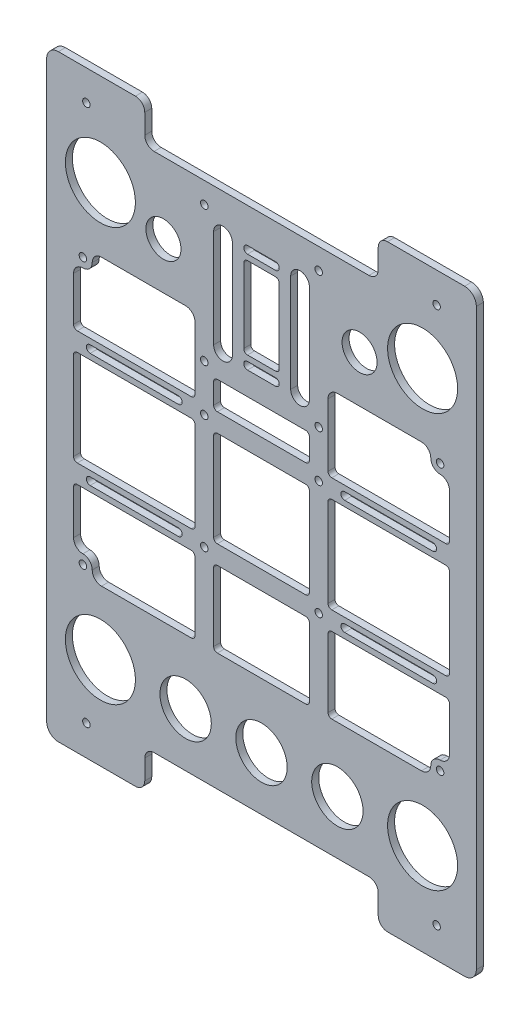
from build123d import *

# Parameters (mm, degrees)
MODEL_R             = 1.6
MODEL_R_2           = 15
MODEL_R_3           = 11
MODEL_R_4           = 7.5
BOSS_EXTRUDE1_DEPTH = 3


with BuildPart() as part:
    # Model → Boss-Extrude1 (new body)
    with BuildSketch(Plane.XY):
        with BuildLine():
            Line((-87, -128), (-54, -128))
            ThreePointArc((-54, -128), (-51.171572875, -126.828427125), (-50, -124))
            Line((-50, -124), (-50, -115.5))
            ThreePointArc((-50, -115.5), (-48.828427125, -112.671572875), (-46, -111.5))
            Line((-46, -111.5), (46, -111.5))
            ThreePointArc((46, -111.5), (48.828427125, -112.671572875), (50, -115.5))
            Line((50, -115.5), (50, -124))
            ThreePointArc((50, -124), (51.171572875, -126.828427125), (54, -128))
            Line((54, -128), (87, -128))
            ThreePointArc((87, -128), (90.535533906, -126.535533906), (92, -123))
            Line((92, -123), (92, 123))
            ThreePointArc((92, 123), (90.535533906, 126.535533906), (87, 128))
            Line((87, 128), (54, 128))
            ThreePointArc((54, 128), (51.171572875, 126.828427125), (50, 124))
            Line((50, 124), (50, 115.5))
            ThreePointArc((50, 115.5), (48.828427125, 112.671572875), (46, 111.5))
            Line((46, 111.5), (-46, 111.5))
            ThreePointArc((-46, 111.5), (-48.828427125, 112.671572875), (-50, 115.5))
            Line((-50, 115.5), (-50, 124))
            ThreePointArc((-50, 124), (-51.171572875, 126.828427125), (-54, 128))
            Line((-54, 128), (-87, 128))
            ThreePointArc((-87, 128), (-90.535533906, 126.535533906), (-92, 123))
            Line((-92, 123), (-92, -123))
            ThreePointArc((-92, -123), (-90.535533906, -126.535533906), (-87, -128))
        make_face()
        with Locations((-75, 115)):
            Circle(MODEL_R, mode=Mode.SUBTRACT)
        with Locations((75, 115)):
            Circle(MODEL_R, mode=Mode.SUBTRACT)
        with Locations((-75, -115)):
            Circle(MODEL_R, mode=Mode.SUBTRACT)
        with Locations((75, -115)):
            Circle(MODEL_R, mode=Mode.SUBTRACT)
        with Locations((-69, 88.5)):
            Circle(MODEL_R_2, mode=Mode.SUBTRACT)
        with Locations((69, 88.5)):
            Circle(MODEL_R_2, mode=Mode.SUBTRACT)
        with Locations((-69, -88.5)):
            Circle(MODEL_R_2, mode=Mode.SUBTRACT)
        with Locations((69, -88.5)):
            Circle(MODEL_R_2, mode=Mode.SUBTRACT)
        with Locations((-24.5, 44.5)):
            Circle(MODEL_R, mode=Mode.SUBTRACT)
        with Locations((24.5, 44.5)):
            Circle(MODEL_R, mode=Mode.SUBTRACT)
        with Locations((-24.5, 102.5)):
            Circle(MODEL_R, mode=Mode.SUBTRACT)
        with Locations((24.5, 102.5)):
            Circle(MODEL_R, mode=Mode.SUBTRACT)
        with Locations((0, -88.5)):
            Circle(MODEL_R_3, mode=Mode.SUBTRACT)
        with Locations((-76.5, -57)):
            Circle(MODEL_R, mode=Mode.SUBTRACT)
        with Locations((-76.5, 57)):
            Circle(MODEL_R, mode=Mode.SUBTRACT)
        with Locations((76.5, -57)):
            Circle(MODEL_R, mode=Mode.SUBTRACT)
        with Locations((76.5, 57)):
            Circle(MODEL_R, mode=Mode.SUBTRACT)
        with Locations((-32.5, -88.5)):
            Circle(MODEL_R_3, mode=Mode.SUBTRACT)
        with Locations((32.5, -88.5)):
            Circle(MODEL_R_3, mode=Mode.SUBTRACT)
        with Locations((-42, 81)):
            Circle(MODEL_R_4, mode=Mode.SUBTRACT)
        with Locations((42, 81)):
            Circle(MODEL_R_4, mode=Mode.SUBTRACT)
        with Locations((-24.5, 24.5)):
            Circle(MODEL_R, mode=Mode.SUBTRACT)
        with Locations((24.5, 24.5)):
            Circle(MODEL_R, mode=Mode.SUBTRACT)
        with Locations((-24.5, -24.5)):
            Circle(MODEL_R, mode=Mode.SUBTRACT)
        with Locations((24.5, -24.5)):
            Circle(MODEL_R, mode=Mode.SUBTRACT)
        with BuildLine():
            Line((-18.9, 40.5), (18.9, 40.5))
            ThreePointArc((18.9, 40.5), (20.03137085, 40.03137085), (20.5, 38.9))
            Line((20.5, 38.9), (20.5, 30.1))
            ThreePointArc((20.5, 30.1), (20.03137085, 28.96862915), (18.9, 28.5))
            Line((18.9, 28.5), (-18.9, 28.5))
            ThreePointArc((-18.9, 28.5), (-20.03137085, 28.96862915), (-20.5, 30.1))
            Line((-20.5, 30.1), (-20.5, 38.9))
            ThreePointArc((-20.5, 38.9), (-20.03137085, 40.03137085), (-18.9, 40.5))
        make_face(mode=Mode.SUBTRACT)
        with BuildLine():
            Line((-68.5, 61), (-32.5, 61))
            ThreePointArc((-32.5, 61), (-29.671572875, 59.828427125), (-28.5, 57))
            Line((-28.5, 57), (-28.5, 30.1))
            ThreePointArc((-28.5, 30.1), (-28.96862915, 28.96862915), (-30.1, 28.5))
            Line((-30.1, 28.5), (-78.9, 28.5))
            ThreePointArc((-78.9, 28.5), (-80.03137085, 28.96862915), (-80.5, 30.1))
            Line((-80.5, 30.1), (-80.5, 49))
            ThreePointArc((-80.5, 49), (-79.328427125, 51.828427125), (-76.5, 53))
            ThreePointArc((-76.5, 53), (-73.671572875, 54.171572875), (-72.5, 57))
            ThreePointArc((-72.5, 57), (-71.328427125, 59.828427125), (-68.5, 61))
        make_face(mode=Mode.SUBTRACT)
        with BuildLine():
            Line((-80.5, 18.9), (-80.5, -18.9))
            ThreePointArc((-80.5, -18.9), (-80.03137085, -20.03137085), (-78.9, -20.5))
            Line((-78.9, -20.5), (-30.1, -20.5))
            ThreePointArc((-30.1, -20.5), (-28.96862915, -20.03137085), (-28.5, -18.9))
            Line((-28.5, -18.9), (-28.5, 18.9))
            ThreePointArc((-28.5, 18.9), (-28.96862915, 20.03137085), (-30.1, 20.5))
            Line((-30.1, 20.5), (-78.9, 20.5))
            ThreePointArc((-78.9, 20.5), (-80.03137085, 20.03137085), (-80.5, 18.9))
        make_face(mode=Mode.SUBTRACT)
        with BuildLine():
            Line((-80.5, -30.1), (-80.5, -49))
            ThreePointArc((-80.5, -49), (-79.328427125, -51.828427125), (-76.5, -53))
            ThreePointArc((-76.5, -53), (-73.671572875, -54.171572875), (-72.5, -57))
            ThreePointArc((-72.5, -57), (-71.328427125, -59.828427125), (-68.5, -61))
            Line((-68.5, -61), (-30.1, -61))
            ThreePointArc((-30.1, -61), (-28.96862915, -60.53137085), (-28.5, -59.4))
            Line((-28.5, -59.4), (-28.5, -30.1))
            ThreePointArc((-28.5, -30.1), (-28.96862915, -28.96862915), (-30.1, -28.5))
            Line((-30.1, -28.5), (-78.9, -28.5))
            ThreePointArc((-78.9, -28.5), (-80.03137085, -28.96862915), (-80.5, -30.1))
        make_face(mode=Mode.SUBTRACT)
        with BuildLine():
            Line((32.5, 61), (68.5, 61))
            ThreePointArc((68.5, 61), (71.328427125, 59.828427125), (72.5, 57))
            ThreePointArc((72.5, 57), (73.671572875, 54.171572875), (76.5, 53))
            ThreePointArc((76.5, 53), (79.328427125, 51.828427125), (80.5, 49))
            Line((80.5, 49), (80.5, 30.1))
            ThreePointArc((80.5, 30.1), (80.03137085, 28.96862915), (78.9, 28.5))
            Line((78.9, 28.5), (30.1, 28.5))
            ThreePointArc((30.1, 28.5), (28.96862915, 28.96862915), (28.5, 30.1))
            Line((28.5, 30.1), (28.5, 57))
            ThreePointArc((28.5, 57), (29.671572875, 59.828427125), (32.5, 61))
        make_face(mode=Mode.SUBTRACT)
        with BuildLine():
            Line((80.5, 18.9), (80.5, -18.9))
            ThreePointArc((80.5, -18.9), (80.03137085, -20.03137085), (78.9, -20.5))
            Line((78.9, -20.5), (30.1, -20.5))
            ThreePointArc((30.1, -20.5), (28.96862915, -20.03137085), (28.5, -18.9))
            Line((28.5, -18.9), (28.5, 18.9))
            ThreePointArc((28.5, 18.9), (28.96862915, 20.03137085), (30.1, 20.5))
            Line((30.1, 20.5), (78.9, 20.5))
            ThreePointArc((78.9, 20.5), (80.03137085, 20.03137085), (80.5, 18.9))
        make_face(mode=Mode.SUBTRACT)
        with BuildLine():
            Line((80.5, -30.1), (80.5, -49))
            ThreePointArc((80.5, -49), (79.328427125, -51.828427125), (76.5, -53))
            ThreePointArc((76.5, -53), (73.671572875, -54.171572875), (72.5, -57))
            ThreePointArc((72.5, -57), (71.328427125, -59.828427125), (68.5, -61))
            Line((68.5, -61), (30.1, -61))
            ThreePointArc((30.1, -61), (28.96862915, -60.53137085), (28.5, -59.4))
            Line((28.5, -59.4), (28.5, -30.1))
            ThreePointArc((28.5, -30.1), (28.96862915, -28.96862915), (30.1, -28.5))
            Line((30.1, -28.5), (78.9, -28.5))
            ThreePointArc((78.9, -28.5), (80.03137085, -28.96862915), (80.5, -30.1))
        make_face(mode=Mode.SUBTRACT)
        with BuildLine():
            Line((-20.5, 52.5), (-20.5, 94.5))
            ThreePointArc((-20.5, 94.5), (-19.328427125, 97.328427125), (-16.5, 98.5))
            ThreePointArc((-16.5, 98.5), (-13.671572875, 97.328427125), (-12.5, 94.5))
            Line((-12.5, 94.5), (-12.5, 52.5))
            ThreePointArc((-12.5, 52.5), (-13.671572875, 49.671572875), (-16.5, 48.5))
            ThreePointArc((-16.5, 48.5), (-19.328427125, 49.671572875), (-20.5, 52.5))
        make_face(mode=Mode.SUBTRACT)
        with BuildLine():
            Line((-18.9, -61), (18.9, -61))
            ThreePointArc((18.9, -61), (20.03137085, -60.53137085), (20.5, -59.4))
            Line((20.5, -59.4), (20.5, -30.1))
            ThreePointArc((20.5, -30.1), (20.03137085, -28.96862915), (18.9, -28.5))
            Line((18.9, -28.5), (-18.9, -28.5))
            ThreePointArc((-18.9, -28.5), (-20.03137085, -28.96862915), (-20.5, -30.1))
            Line((-20.5, -30.1), (-20.5, -59.4))
            ThreePointArc((-20.5, -59.4), (-20.03137085, -60.53137085), (-18.9, -61))
        make_face(mode=Mode.SUBTRACT)
        with BuildLine():
            Line((-6, 96.6), (6, 96.6))
            ThreePointArc((6, 96.6), (7.6, 95), (6, 93.4))
            Line((6, 93.4), (-6, 93.4))
            ThreePointArc((-6, 93.4), (-7.6, 95), (-6, 96.6))
        make_face(mode=Mode.SUBTRACT)
        with BuildLine():
            Line((-6, 53.6), (6, 53.6))
            ThreePointArc((6, 53.6), (7.6, 52), (6, 50.4))
            Line((6, 50.4), (-6, 50.4))
            ThreePointArc((-6, 50.4), (-7.6, 52), (-6, 53.6))
        make_face(mode=Mode.SUBTRACT)
        with BuildLine():
            Line((-6, 91), (6, 91))
            ThreePointArc((6, 91), (7.13137085, 90.53137085), (7.6, 89.4))
            Line((7.6, 89.4), (7.6, 57.6))
            ThreePointArc((7.6, 57.6), (7.13137085, 56.46862915), (6, 56))
            Line((6, 56), (-6, 56))
            ThreePointArc((-6, 56), (-7.13137085, 56.46862915), (-7.6, 57.6))
            Line((-7.6, 57.6), (-7.6, 89.4))
            ThreePointArc((-7.6, 89.4), (-7.13137085, 90.53137085), (-6, 91))
        make_face(mode=Mode.SUBTRACT)
        with BuildLine():
            Line((20.5, 52.5), (20.5, 94.5))
            ThreePointArc((20.5, 94.5), (19.328427125, 97.328427125), (16.5, 98.5))
            ThreePointArc((16.5, 98.5), (13.671572875, 97.328427125), (12.5, 94.5))
            Line((12.5, 94.5), (12.5, 52.5))
            ThreePointArc((12.5, 52.5), (13.671572875, 49.671572875), (16.5, 48.5))
            ThreePointArc((16.5, 48.5), (19.328427125, 49.671572875), (20.5, 52.5))
        make_face(mode=Mode.SUBTRACT)
        with BuildLine():
            Line((-20.5, 18.9), (-20.5, -18.9))
            ThreePointArc((-20.5, -18.9), (-20.03137085, -20.03137085), (-18.9, -20.5))
            Line((-18.9, -20.5), (18.9, -20.5))
            ThreePointArc((18.9, -20.5), (20.03137085, -20.03137085), (20.5, -18.9))
            Line((20.5, -18.9), (20.5, 18.9))
            ThreePointArc((20.5, 18.9), (20.03137085, 20.03137085), (18.9, 20.5))
            Line((18.9, 20.5), (-18.9, 20.5))
            ThreePointArc((-18.9, 20.5), (-20.03137085, 20.03137085), (-20.5, 18.9))
        make_face(mode=Mode.SUBTRACT)
        with BuildLine():
            Line((-73.4, 26.1), (-35.6, 26.1))
            ThreePointArc((-35.6, 26.1), (-34, 24.5), (-35.6, 22.9))
            Line((-35.6, 22.9), (-73.4, 22.9))
            ThreePointArc((-73.4, 22.9), (-75, 24.5), (-73.4, 26.1))
        make_face(mode=Mode.SUBTRACT)
        with BuildLine():
            Line((-73.4, -26.1), (-35.6, -26.1))
            ThreePointArc((-35.6, -26.1), (-34, -24.5), (-35.6, -22.9))
            Line((-35.6, -22.9), (-73.4, -22.9))
            ThreePointArc((-73.4, -22.9), (-75, -24.5), (-73.4, -26.1))
        make_face(mode=Mode.SUBTRACT)
        with BuildLine():
            Line((35.6, 26.1), (73.4, 26.1))
            ThreePointArc((73.4, 26.1), (75, 24.5), (73.4, 22.9))
            Line((73.4, 22.9), (35.6, 22.9))
            ThreePointArc((35.6, 22.9), (34, 24.5), (35.6, 26.1))
        make_face(mode=Mode.SUBTRACT)
        with BuildLine():
            Line((35.6, -26.1), (73.4, -26.1))
            ThreePointArc((73.4, -26.1), (75, -24.5), (73.4, -22.9))
            Line((73.4, -22.9), (35.6, -22.9))
            ThreePointArc((35.6, -22.9), (34, -24.5), (35.6, -26.1))
        make_face(mode=Mode.SUBTRACT)
    extrude(amount=BOSS_EXTRUDE1_DEPTH)


solid = part.part
